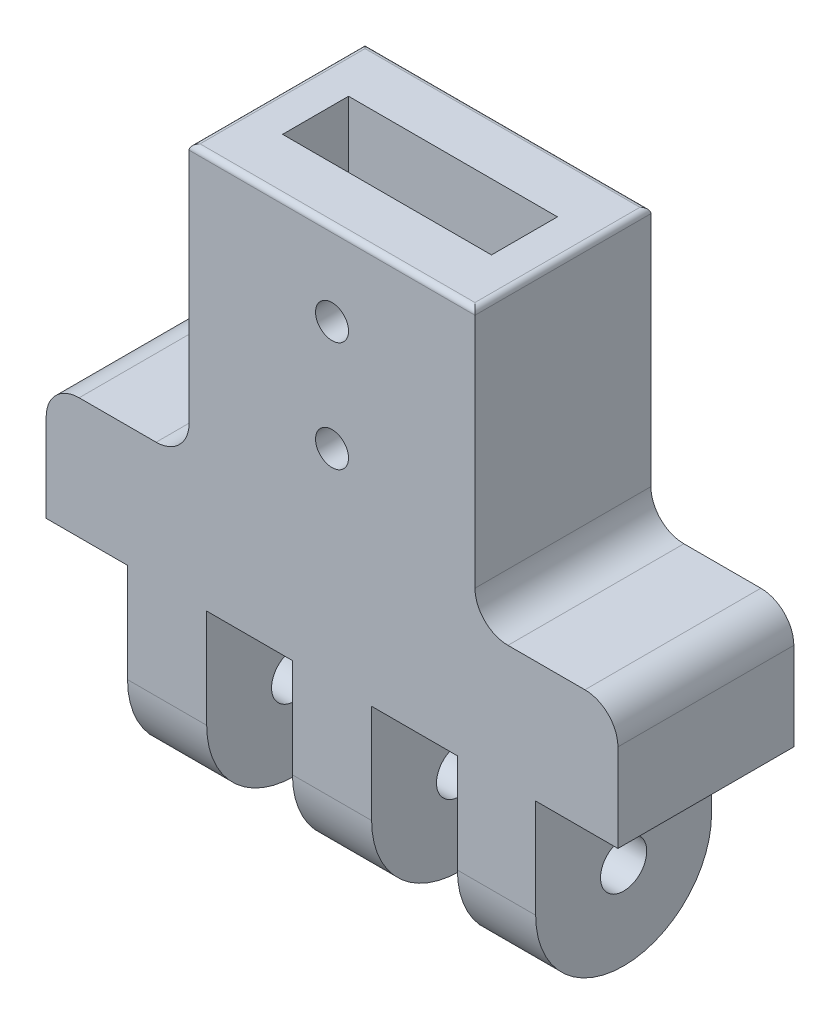
from build123d import *

# Parameters (mm, degrees)
SKETCH2_R           = 2.1
BOSS_EXTRUDE1_DEPTH = 26
SKETCH3_W           = 7.4
SKETCH3_H           = 18
SKETCH3_W_2         = 7.8
SKETCH3_W_3         = 7.481047655
CUT_EXTRUDE1_DEPTH  = 37.496575182
SKETCH4_W           = 26
SKETCH4_H           = 16
BOSS_EXTRUDE2_DEPTH = 25
SKETCH5_W           = 19
SKETCH5_H           = 6
CUT_EXTRUDE2_DEPTH  = 25
FILLET2_R           = 3
SKETCH6_R           = 1.5
CUT_EXTRUDE3_DEPTH  = 12.5
FILLET3_R           = 0.5
FILLET4_R           = 3


with BuildPart() as part:
    # Sketch2 → Boss-Extrude1 (new, symmetric)
    with BuildSketch(Plane(origin=(0, 0, 0), x_dir=(0, 0, -1), z_dir=(1, 0, 0))):
        with BuildLine():
            Line((-8, 0), (-8, 20))
            Line((-8, 20), (8, 20))
            Line((8, 20), (8, 0))
            ThreePointArc((8, 0), (0, -8), (-8, 0))
        make_face()
        Circle(SKETCH2_R, mode=Mode.SUBTRACT)
    extrude(amount=BOSS_EXTRUDE1_DEPTH, both=True)

    # Sketch3 → Cut-Extrude1 (cut, through all)
    with BuildSketch(Plane.XY.offset(8)):
        with Locations((-22.3, 0)):
            Rectangle(SKETCH3_W, SKETCH3_H)
        with Locations((-7.5, 0)):
            Rectangle(SKETCH3_W_2, SKETCH3_H)
        with Locations((7.5, 0)):
            Rectangle(SKETCH3_W_2, SKETCH3_H)
        with Locations((22.259476173, 0)):
            Rectangle(SKETCH3_W_3, SKETCH3_H)
    extrude(amount=-CUT_EXTRUDE1_DEPTH, mode=Mode.SUBTRACT)

    # Sketch4 → Boss-Extrude2 (add)
    with BuildSketch(Plane(origin=(0, 20, 0), x_dir=(1, 0, 0), z_dir=(0, 1, 0))):
        Rectangle(SKETCH4_W, SKETCH4_H)
    extrude(amount=BOSS_EXTRUDE2_DEPTH)

    # Sketch5 → Cut-Extrude2 (cut)
    with BuildSketch(Plane(origin=(0, 45, 0), x_dir=(1, 0, 0), z_dir=(0, 1, 0))):
        Rectangle(SKETCH5_W, SKETCH5_H)
    extrude(amount=-CUT_EXTRUDE2_DEPTH, mode=Mode.SUBTRACT)

    # Fillet2
    fillet2_edges = [part.edges().sort_by_distance(p)[0] for p in [
        (26, 20, 0),
        (-26, 20, 0),
    ]]
    fillet(fillet2_edges, radius=FILLET2_R)

    # Sketch6 → Cut-Extrude3 (cut, symmetric)
    with BuildSketch(Plane.XY):
        with Locations((0, 37.5)):
            Circle(SKETCH6_R)
        with Locations((0, 27.5)):
            Circle(SKETCH6_R)
    extrude(amount=CUT_EXTRUDE3_DEPTH, both=True, mode=Mode.SUBTRACT)

    # Fillet3
    fillet3_edges = [part.edges().sort_by_distance(p)[0] for p in [
        (0, 45, 8),
        (13, 45, 0),
        (0, 45, -8),
        (-13, 45, 0),
    ]]
    fillet(fillet3_edges, radius=FILLET3_R)

    # Fillet4
    fillet4_edges = [part.edges().sort_by_distance(p)[0] for p in [
        (13, 20, 0),
        (-13, 20, 0),
    ]]
    fillet(fillet4_edges, radius=FILLET4_R)


solid = part.part
